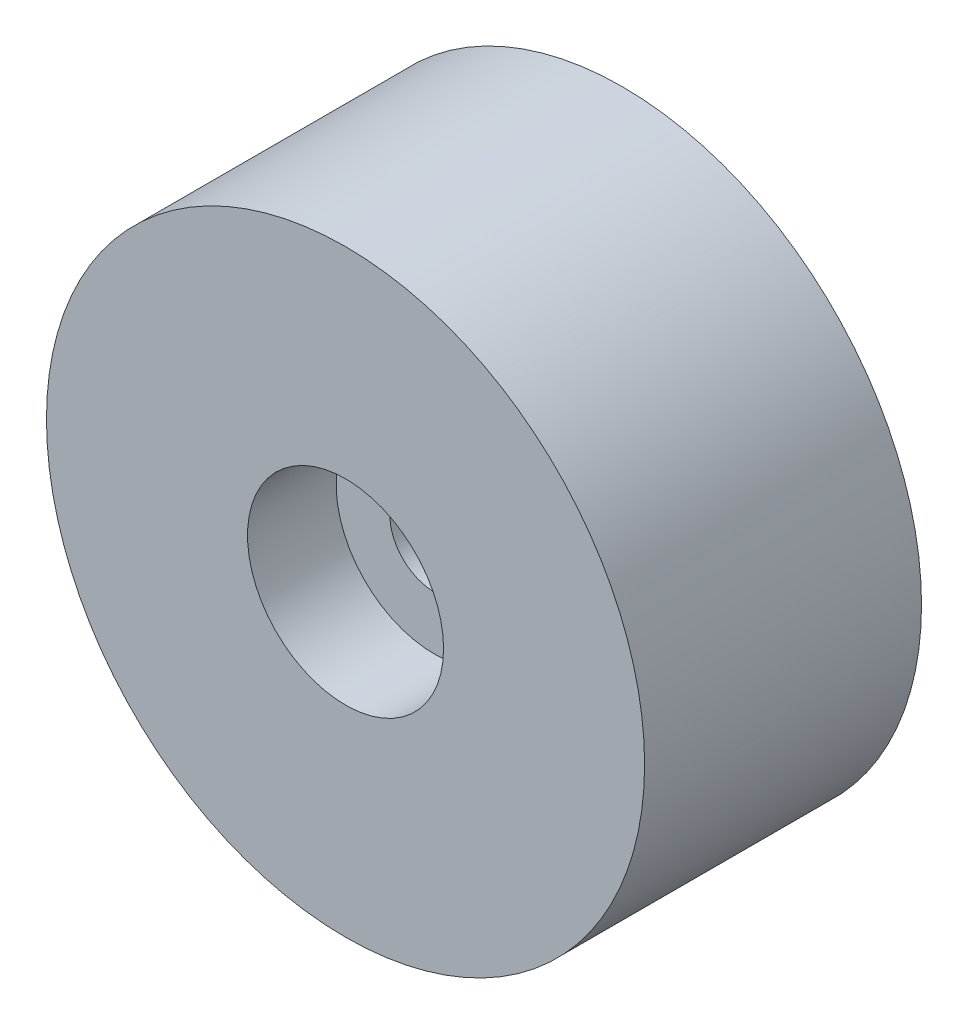
from build123d import *

# Parameters (mm, degrees)
ESQUISSE1_R             = 27
BOSS_EXTRU_1_DEPTH      = 25
ESQUISSE2_R             = 8.85
ENL_V_MAT_EXTRU_1_DEPTH = 8
ESQUISSE3_R             = 4
ENL_V_MAT_EXTRU_2_DEPTH = 42.797129088


with BuildPart() as part:
    # Esquisse1 → Boss.-Extru.1 (new body)
    with BuildSketch(Plane.XY):
        Circle(ESQUISSE1_R)
    extrude(amount=BOSS_EXTRU_1_DEPTH)

    # Esquisse2 → Enlèv. mat.-Extru.1 (cut)
    with BuildSketch(Plane.XY.offset(25)):
        Circle(ESQUISSE2_R)
    extrude(amount=-ENL_V_MAT_EXTRU_1_DEPTH, mode=Mode.SUBTRACT)

    # Esquisse3 → Enlèv. mat.-Extru.2 (cut, through all)
    with BuildSketch(Plane.XY.offset(17)):
        Circle(ESQUISSE3_R)
    extrude(amount=-ENL_V_MAT_EXTRU_2_DEPTH, mode=Mode.SUBTRACT)


solid = part.part
